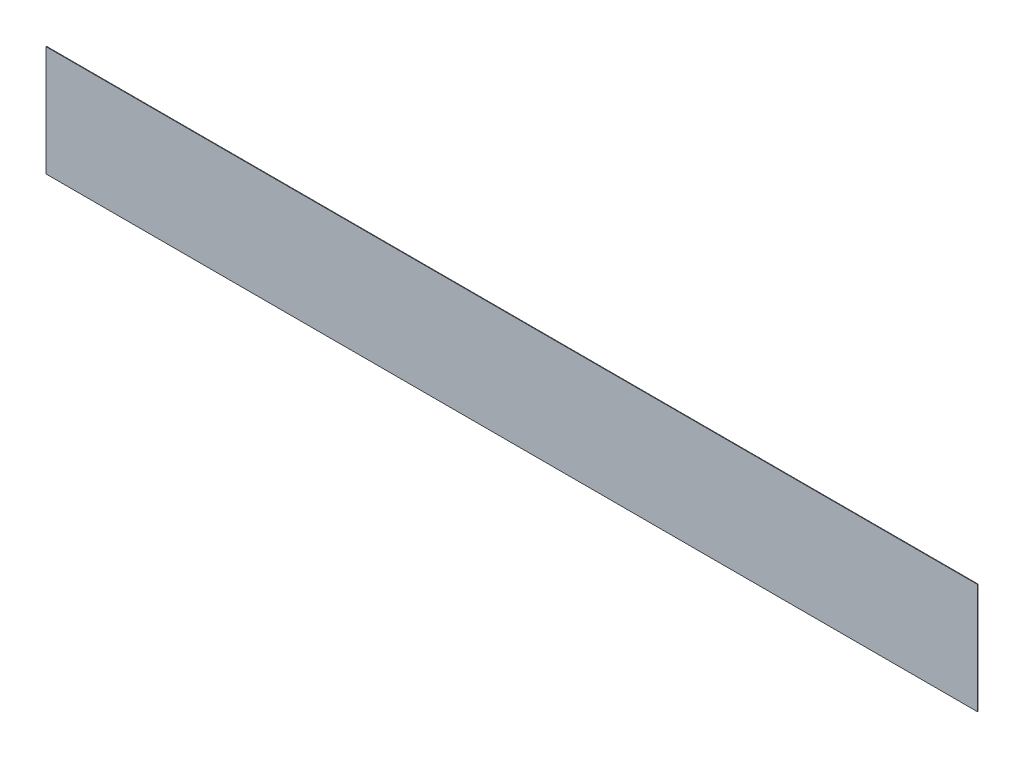
from build123d import *

# Parameters (mm, degrees)
SKETCH_1_W             = 1300.5
SKETCH_1_H             = 154
SM_BASE_FLANGE_1_DEPTH = 0.8


# Sheet-metal steps are written as plain solids
with BuildPart() as part:
    # Sketch 1 → 基体-法兰1 (new body)
    with BuildSketch(Plane.XY):
        Rectangle(SKETCH_1_W, SKETCH_1_H)
    extrude(amount=-SM_BASE_FLANGE_1_DEPTH)


solid = part.part
